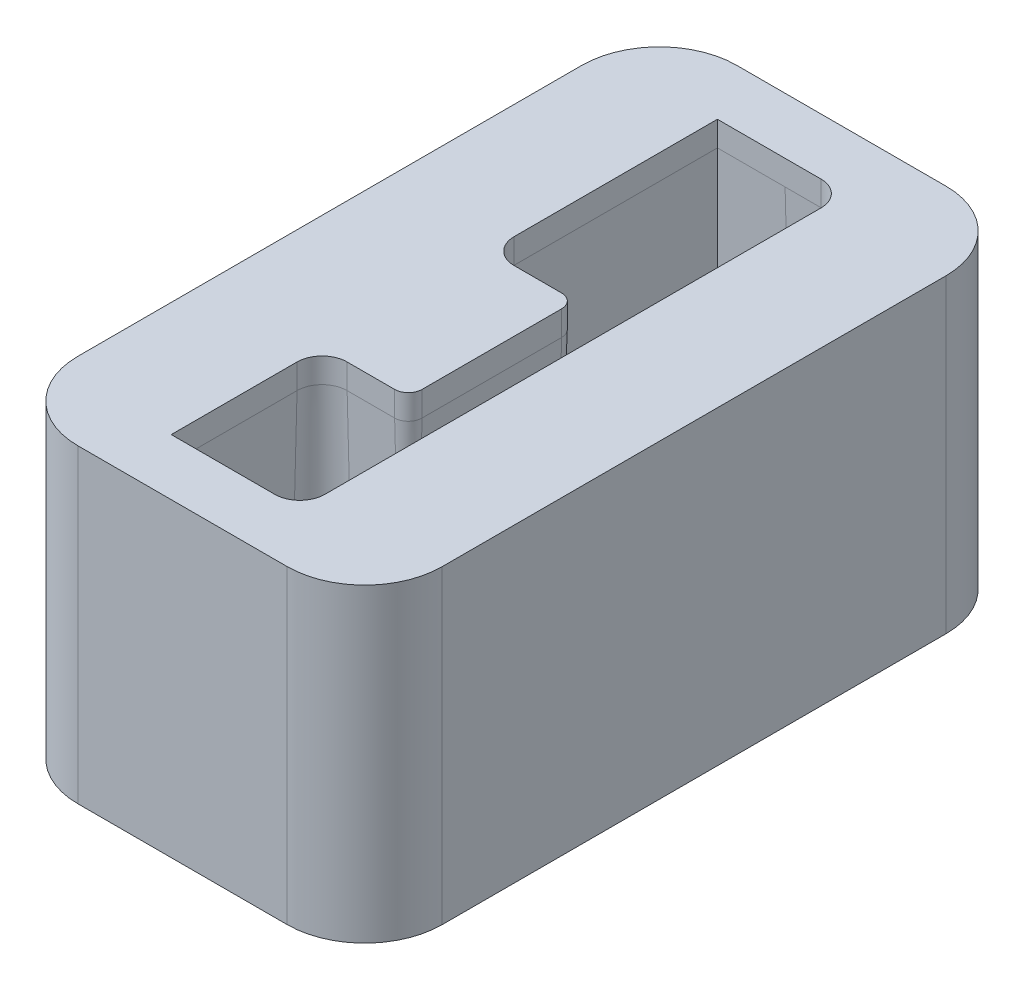
from build123d import *

# Parameters (mm, degrees)
SKETCH1_W                   = 47
SKETCH1_H                   = 85
BOSS_EXTRUDE1_DEPTH         = 40
FILLET1_R                   = 10
CUT_EXTRUDE1_REACH          = 64.917
M6_TAPPED_HOLE1_D           = 5
M6_TAPPED_HOLE1_DEPTH       = 17
M6_TAPPED_HOLE1_CSINK_D     = 6.05
M6_TAPPED_HOLE1_CSINK_ANGLE = 90
M6_TAPPED_HOLE1_TIP         = 1.502151548


with BuildPart() as part:
    # Sketch1 → Boss-Extrude1 (new body)
    with BuildSketch(Plane(origin=(0, 0, 0), x_dir=(1, 0, 0), z_dir=(0, 1, 0))):
        Rectangle(SKETCH1_W, SKETCH1_H)
    extrude(amount=-BOSS_EXTRUDE1_DEPTH)

    # Fillet1
    fillet1_edges = [part.edges().sort_by_distance(p)[0] for p in [
        (-23.5, -20, -42.5),
        (23.5, -20, -42.5),
        (-23.5, -20, 42.5),
        (23.5, -20, 42.5),
    ]]
    fillet(fillet1_edges, radius=FILLET1_R)

    # Sketch3 → Cut-Extrude1 (cut, up to next)
    with BuildSketch(Plane(origin=(0, 0, 0), x_dir=(1, 0, 0), z_dir=(0, 1, 0)), mode=Mode.PRIVATE) as cut_extrude1_sk1:
        with BuildLine():
            Line((4.63, 35.23), (-8.73, 35.23))
            Line((-8.73, 35.23), (-8.73, 9))
            ThreePointArc((-8.73, 9), (-7.783954903, 6.716045097), (-5.5, 5.77))
            Line((-5.5, 5.77), (0.63, 5.77))
            ThreePointArc((0.63, 5.77), (1.881579003, 5.251579003), (2.4, 4))
            Line((2.4, 4), (2.4, -14))
            ThreePointArc((2.4, -14), (1.881579003, -15.251579003), (0.63, -15.77))
            Line((0.63, -15.77), (-5.5, -15.77))
            ThreePointArc((-5.5, -15.77), (-7.783954903, -16.716045097), (-8.73, -19))
            Line((-8.73, -19), (-8.73, -35.23))
            Line((-8.73, -35.23), (4.63, -35.23))
            ThreePointArc((4.63, -35.23), (6.913954903, -34.283954903), (7.86, -32))
            Line((7.86, -32), (7.86, 32))
            ThreePointArc((7.86, 32), (6.913954903, 34.283954903), (4.63, 35.23))
        make_face()
    cut_extrude1_tool1 = extrude(cut_extrude1_sk1.sketch, amount=-CUT_EXTRUDE1_REACH, mode=Mode.PRIVATE) & part.part
    add(cut_extrude1_tool1.solids().sort_by_distance((6.402103, 0, -33.772103))[0], mode=Mode.SUBTRACT)

    # Cut-Sweep1: sweep along a path in Sketch5
    with BuildLine(Plane(origin=(0, 0, 0), x_dir=(1, 0, 0), z_dir=(0, 1, 0))) as cut_sweep1_path:
        Line((-8.73, -35.23), (4.63, -35.23))
        ThreePointArc((4.63, -35.23), (6.913954903, -34.283954903), (7.86, -32))
        Line((7.86, -32), (7.86, 32))
        ThreePointArc((7.86, 32), (6.913954903, 34.283954903), (4.63, 35.23))
        Line((4.63, 35.23), (-8.73, 35.23))
        Line((-8.73, 35.23), (-8.73, 9))
        ThreePointArc((-8.73, 9), (-7.783954903, 6.716045097), (-5.5, 5.77))
        Line((-5.5, 5.77), (0.63, 5.77))
        ThreePointArc((0.63, 5.77), (1.881579003, 5.251579003), (2.4, 4))
        Line((2.4, 4), (2.4, -14))
        ThreePointArc((2.4, -14), (1.881579003, -15.251579003), (0.63, -15.77))
        Line((0.63, -15.77), (-5.5, -15.77))
        ThreePointArc((-5.5, -15.77), (-7.783954903, -16.716045097), (-8.73, -19))
        Line((-8.73, -19), (-8.73, -35.23))
    # Sketch4 → Cut-Sweep1 (sweep, cut)
    with BuildSketch(Plane(origin=(0, 0, 0), x_dir=(0, 0, -1), z_dir=(1, 0, 0))):
        Polygon((35.23, -3.2), (36.193641914, -40), (35.23, -40), align=None)
    sweep(path=cut_sweep1_path.line, transition=Transition.RIGHT, mode=Mode.SUBTRACT)

    # M6 Tapped Hole1
    with Locations(Plane(origin=(0, -40, 0), x_dir=(-1, 0, 0), z_dir=(0, -1, 0))):
        with Locations((-16.5, 35.5), (16.5, 35.5), (16.5, -35.5), (-16.5, -35.5)):
            CounterSinkHole(M6_TAPPED_HOLE1_D / 2, M6_TAPPED_HOLE1_CSINK_D / 2, depth=M6_TAPPED_HOLE1_DEPTH, counter_sink_angle=M6_TAPPED_HOLE1_CSINK_ANGLE)
            with Locations((0, 0, -(M6_TAPPED_HOLE1_DEPTH + M6_TAPPED_HOLE1_TIP / 2))):  # 118° drill point
                Cone(0, M6_TAPPED_HOLE1_D / 2, M6_TAPPED_HOLE1_TIP, mode=Mode.SUBTRACT)


solid = part.part
